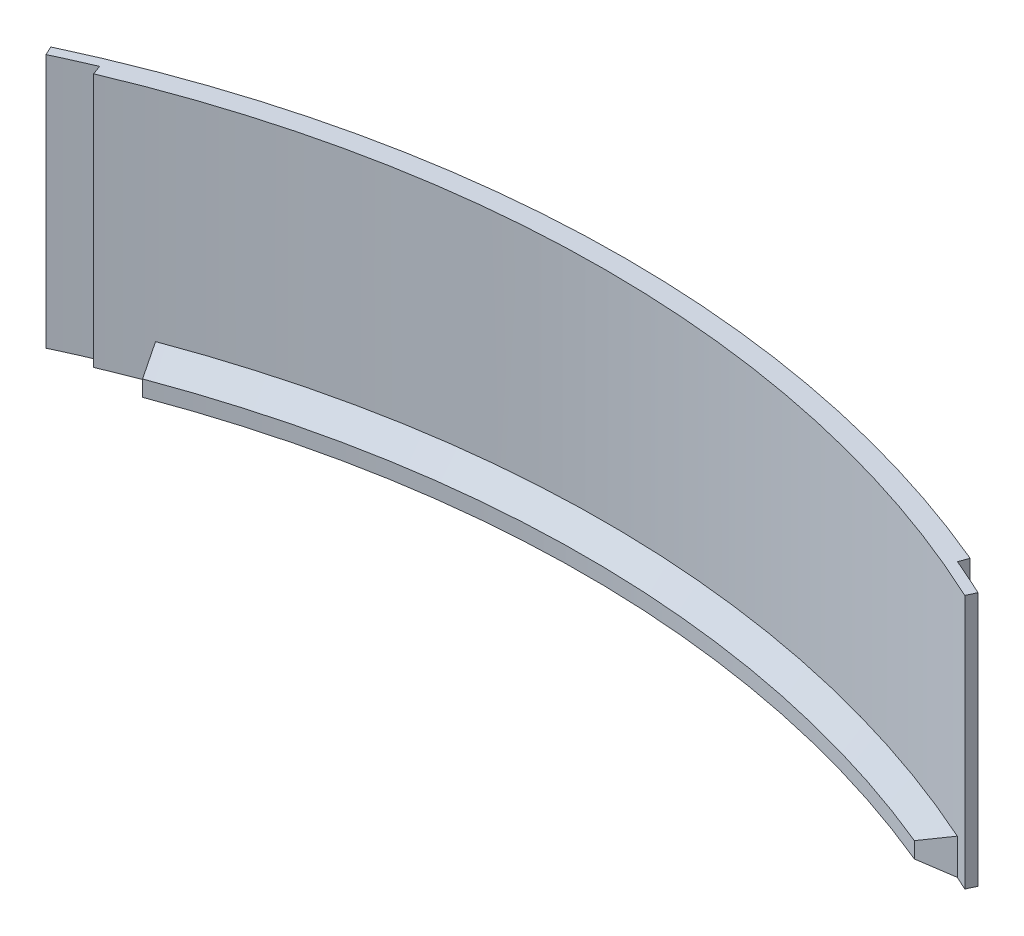
from build123d import *

# Parameters (mm, degrees)
BOSS_EXTRUDE1_DEPTH = 16
BOSS_EXTRUDE2_START = -2
BOSS_EXTRUDE2_DEPTH = 2
CHAMFER2_SIZE       = 2.5


with BuildPart() as part:
    # Sketch2 → Boss-Extrude1 (new, symmetric)
    with BuildSketch(Plane(origin=(0, 0, 0), x_dir=(1, 0, 0), z_dir=(0, 1, 0))):
        with BuildLine():
            Line((-58.637924155, 125.749434155), (-59.166556644, 126.883090185))
            ThreePointArc((-59.166556644, 126.883090185), (-2.609123321, 139.975685301), (54.396940678, 128.999894748))
            Line((54.396940678, 128.999894748), (53.971953665, 127.832252528))
            ThreePointArc((53.971953665, 127.832252528), (56.314568974, 126.8124168), (58.637924155, 125.749434155))
            Line((58.637924155, 125.749434155), (58.110010989, 124.617320718))
            ThreePointArc((58.110010989, 124.617320718), (2.5, 137.477270849), (-53.540801289, 126.647671109))
            Line((-53.540801289, 126.647671109), (-53.971953665, 127.832252528))
            ThreePointArc((-53.971953665, 127.832252528), (-56.314568974, 126.8124168), (-58.637924155, 125.749434155))
        make_face()
    extrude(amount=BOSS_EXTRUDE1_DEPTH, both=True)

    # Sketch3 → Boss-Extrude2 (add)
    with BuildSketch(Plane.XZ.offset(16).offset(BOSS_EXTRUDE2_START)):
        with BuildLine():
            Line((49.470958786, -133.637099029), (48.718270464, -131.249876659))
            ThreePointArc((48.718270464, -131.249876659), (-2.609123321, -139.975685301), (-53.575680531, -129.343134552))
            Line((-53.575680531, -129.343134552), (-58.637924155, -125.749434155))
            Line((-58.637924155, -125.749434155), (-54.532389112, -131.652833383))
            ThreePointArc((-54.532389112, -131.652833383), (-2.718243325, -142.474071863), (49.470958786, -133.637099029))
        make_face()
        with BuildLine():
            Line((52.61897195, -127.033435721), (58.637924155, -125.749434155))
            Line((58.637924155, -125.749434155), (51.662263369, -124.723736889))
            ThreePointArc((51.662263369, -124.723736889), (2.390873136, -134.978826953), (-47.212790972, -126.475105727))
            Line((-47.212790972, -126.475105727), (-47.965548485, -128.86254754))
            ThreePointArc((-47.965548485, -128.86254754), (2.5, -137.477270849), (52.61897195, -127.033435721))
        make_face()
    extrude(amount=BOSS_EXTRUDE2_DEPTH)

    # Chamfer2
    chamfer2_edges = [part.edges().sort_by_distance(p)[0] for p in [
        (-4.601256001, -14, -139.924366867),
        (4.540431296, -14, -137.425014039),
    ]]
    chamfer(chamfer2_edges, length=CHAMFER2_SIZE - 0.0001)  # a hair under: the kernel refuses the full size


solid = part.part
